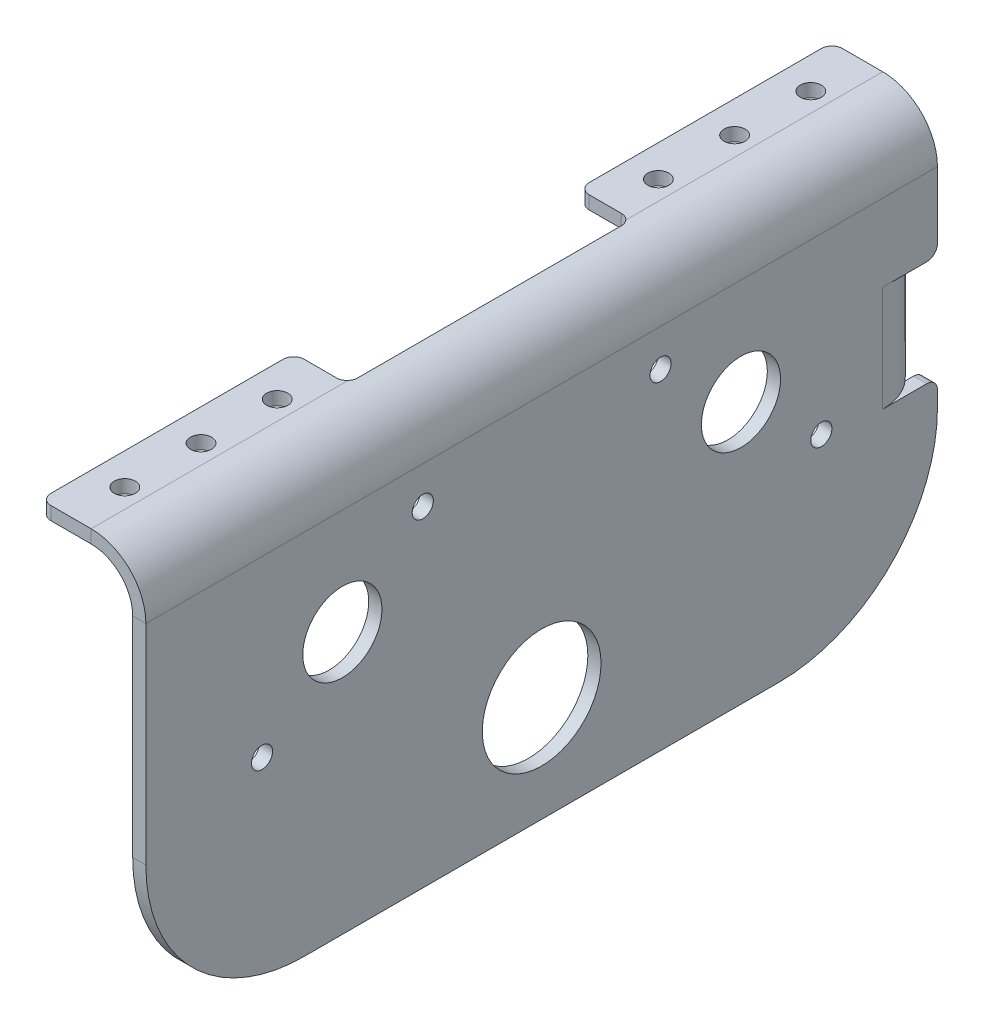
from build123d import *

# Parameters (mm, degrees)
SKETCH1_W                    = 190.5
SKETCH1_H                    = 101.6
BOSS_EXTRUDE1_DEPTH          = 3.175
SKETCH2_R                    = 14.2875
CUT_EXTRUDE1_DEPTH           = 3.175
EDGE_FLANGE1_STRIP_W         = 32.7
EDGE_FLANGE1_STRIP_H         = 3.175
EDGE_FLANGE1_STRIP_CUT_DEPTH = 190.5
EDGE_FLANGE1_DEPTH           = 190.5
SKETCH12_R                   = 9.525
SKETCH12_R_2                 = 2.54
CUT_EXTRUDE2_DEPTH           = 7.62
FILLET1_R                    = 38.1
SKETCH13_W                   = 3.175
SKETCH13_H                   = 25.4
BOSS_EXTRUDE2_DEPTH          = 0.000254
EDGE_FLANGE2_STRIP_W         = 32.7
EDGE_FLANGE2_STRIP_H         = 3.175
EDGE_FLANGE2_STRIP_CUT_DEPTH = 25.4
EDGE_FLANGE2_DEPTH           = 25.4
SKETCH17_R                   = 2.54
CUT_EXTRUDE3_DEPTH           = 142.028796748
SKETCH18_R                   = 2.54
CUT_EXTRUDE4_DEPTH           = 199.405991339
CUT_EXTRUDE5_START           = -34.29
CUT_EXTRUDE5_DEPTH           = 68.58
FILLET3_R                    = 2.54
FILLET4_R                    = 2.54


# Read off the part's stored shape, not the designer's step: Cut-Extrude5
# Sheet-metal steps are written as plain solids
with BuildPart() as part:
    # Sketch1 → Boss-Extrude1 (new body)
    with BuildSketch(Plane(origin=(0, 0, 0), x_dir=(0, 0, -1), z_dir=(1, 0, 0))):
        Rectangle(SKETCH1_W, SKETCH1_H)
    extrude(amount=BOSS_EXTRUDE1_DEPTH)

    # Sketch2 → Cut-Extrude1 (cut)
    with BuildSketch(Plane(origin=(3.175, 0, 0), x_dir=(0, 0, -1), z_dir=(1, 0, 0))):
        with Locations((0, -25.4)):
            Circle(SKETCH2_R)
    extrude(amount=-CUT_EXTRUDE1_DEPTH, mode=Mode.SUBTRACT)

    # Edge-Flange1 strip (across the edge) → Edge-Flange1 strip cut (cut)
    with BuildSketch(Plane(origin=(0, 50.8, 95.25), x_dir=(0, -1, 0), z_dir=(0, 0, -1))):
        with Locations((-3.175, -1.5875)):
            Rectangle(EDGE_FLANGE1_STRIP_W, EDGE_FLANGE1_STRIP_H)
    extrude(amount=EDGE_FLANGE1_STRIP_CUT_DEPTH, mode=Mode.SUBTRACT)

    # Edge-Flange1 section (across the edge) → Edge-Flange1 (add)
    with BuildSketch(Plane(origin=(0, 50.8, 95.25), x_dir=(0, -1, 0), z_dir=(0, 0, -1))):
        with BuildLine():
            Line((0, 10), (0, 22.225))
            Line((0, 22.225), (3.175, 22.225))
            Line((3.175, 22.225), (3.175, 10))
            ThreePointArc((3.175, 10), (6.103932188, 2.928932188), (13.175, 0))
            Line((13.175, 0), (13.175, -3.175))
            ThreePointArc((13.175, -3.175), (3.858868158, 0.683868158), (0, 10))
        make_face()
    extrude(amount=EDGE_FLANGE1_DEPTH)

    # Sketch12 → Cut-Extrude2 (cut)
    with BuildSketch(Plane(origin=(3.175, 0, 0), x_dir=(0, 0, -1), z_dir=(1, 0, 0))):
        with Locations((-47.963329482, 12.225)):
            Circle(SKETCH12_R)
        with Locations((-28.616658964, 28.683017495)):
            Circle(SKETCH12_R_2)
        with Locations((-67.31, -4.233017495)):
            Circle(SKETCH12_R_2)
        with Locations((47.963329482, 12.225)):
            Circle(SKETCH12_R)
        with Locations((28.616658964, 28.683017495)):
            Circle(SKETCH12_R_2)
        with Locations((67.31, -4.233017495)):
            Circle(SKETCH12_R_2)
    extrude(amount=-CUT_EXTRUDE2_DEPTH, mode=Mode.SUBTRACT)

    # Fillet1
    fillet1_edges = [part.edges().sort_by_distance(p)[0] for p in [
        (1.5875, -50.8, 95.25),
        (1.5875, -50.8, -95.25),
    ]]
    fillet(fillet1_edges, radius=FILLET1_R)

    # Sketch13 → Boss-Extrude2 (add)
    with BuildSketch(Plane(origin=(0, 0, -95.25), x_dir=(-1, 0, 0), z_dir=(0, 0, -1))):
        with Locations((-1.5875, 6.35)):
            Rectangle(SKETCH13_W, SKETCH13_H)
    extrude(amount=BOSS_EXTRUDE2_DEPTH)

    # Edge-Flange2 strip (across the edge) → Edge-Flange2 strip cut (cut)
    with BuildSketch(Plane(origin=(0, 19.05, -95.250254), x_dir=(0, 0, 1), z_dir=(0, -1, 0))):
        with Locations((-3.175, -1.5875)):
            Rectangle(EDGE_FLANGE2_STRIP_W, EDGE_FLANGE2_STRIP_H)
    extrude(amount=EDGE_FLANGE2_STRIP_CUT_DEPTH, mode=Mode.SUBTRACT)

    # Edge-Flange2 section (across the edge) → Edge-Flange2 (add)
    with BuildSketch(Plane(origin=(0, 19.05, -95.250254), x_dir=(0, 0, 1), z_dir=(0, -1, 0))):
        with BuildLine():
            Line((0, 10), (0, 22.225))
            Line((0, 22.225), (3.175, 22.225))
            Line((3.175, 22.225), (3.175, 10))
            ThreePointArc((3.175, 10), (6.103932188, 2.928932188), (13.175, 0))
            Line((13.175, 0), (13.175, -3.175))
            ThreePointArc((13.175, -3.175), (3.858868158, 0.683868158), (0, 10))
        make_face()
    extrude(amount=EDGE_FLANGE2_DEPTH)

    # Sketch17 → Cut-Extrude3 (cut, through all)
    with BuildSketch(Plane(origin=(0, 50.8, 0), x_dir=(1, 0, 0), z_dir=(0, 1, 0))):
        with Locations(Location((-14.605, 82.55, 0), (0, 0, 180))):
            Circle(SKETCH17_R)
        with Locations(Location((-14.605, 64.205555556, 0), (0, 0, 180))):
            Circle(SKETCH17_R)
        with Locations(Location((-14.605, 45.861111111, 0), (0, 0, 180))):
            Circle(SKETCH17_R)
        with Locations(Location((-14.605, 27.516666667, 0), (0, 0, 180))):
            Circle(SKETCH17_R)
        with Locations(Location((-14.605, 9.172222222, 0), (0, 0, 180))):
            Circle(SKETCH17_R)
        with Locations(Location((-14.605, -9.172222222, 0), (0, 0, 180))):
            Circle(SKETCH17_R)
        with Locations(Location((-14.605, -27.516666667, 0), (0, 0, 180))):
            Circle(SKETCH17_R)
        with Locations(Location((-14.605, -45.861111111, 0), (0, 0, 180))):
            Circle(SKETCH17_R)
        with Locations(Location((-14.605, -64.205555556, 0), (0, 0, 180))):
            Circle(SKETCH17_R)
        with Locations(Location((-14.605, -82.55, 0), (0, 0, 180))):
            Circle(SKETCH17_R)
    extrude(amount=-CUT_EXTRUDE3_DEPTH, mode=Mode.SUBTRACT)

    # Sketch18 → Cut-Extrude4 (cut, through all)
    with BuildSketch(Plane(origin=(0, 0, -95.250254), x_dir=(-1, 0, 0), z_dir=(0, 0, -1))):
        with Locations((16.35, 12.7)):
            Circle(SKETCH18_R)
        with Locations((16.35, 0)):
            Circle(SKETCH18_R)
    extrude(amount=-CUT_EXTRUDE4_DEPTH, mode=Mode.SUBTRACT)

    # Cut-Extrude5 outline → Cut-Extrude5 (cut)
    with BuildSketch(Plane.XY.offset(CUT_EXTRUDE5_START)):
        with BuildLine():
            ThreePointArc((-10, 47.625), (-9.762432951, 47.622177697), (-9.525, 47.61371238))
            Line((-9.525, 47.61371238), (-9.3741875, 50.78512856))
            ThreePointArc((-9.3741875, 50.78512856), (-9.687005413, 50.796281615), (-10, 50.8))
            Line((-10, 50.8), (-22.225, 50.8))
            Line((-22.225, 50.8), (-22.225, 47.625))
            Line((-22.225, 47.625), (-10, 47.625))
        make_face()
    extrude(amount=CUT_EXTRUDE5_DEPTH, mode=Mode.SUBTRACT)

    # Fillet3
    fillet3_edges = [part.edges().sort_by_distance(p)[0] for p in [
        (-22.225, 49.2125, 95.25),
        (-22.225, 49.2125, 34.29),
        (-9.44959375, 49.19942047, 34.29),
        (-9.44959375, 49.19942047, -34.29),
        (-22.225, 49.2125, -34.29),
        (-22.225, 49.2125, -95.25),
    ]]
    fillet(fillet3_edges, radius=FILLET3_R)

    # Fillet4
    fillet4_edges = [part.edges().sort_by_distance(p)[0] for p in [
        (1.5875, -6.35, -95.25),
        (1.5875, 19.05, -95.25),
    ]]
    fillet(fillet4_edges, radius=FILLET4_R)


solid = part.part
